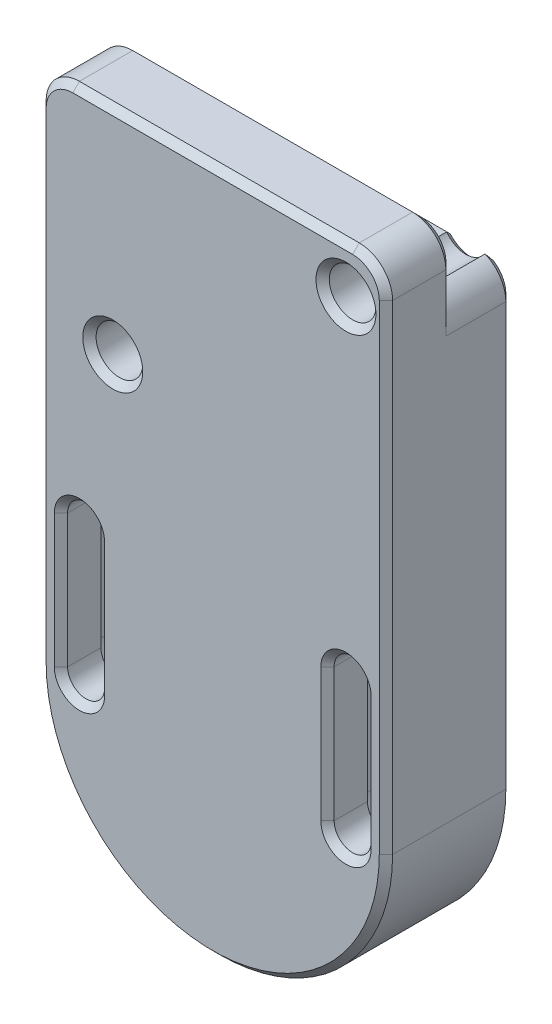
from build123d import *

# Parameters (mm, degrees)
SKETCH1_R           = 3.5
BOSS_EXTRUDE1_DEPTH = 19
CUT_EXTRUDE1_DEPTH  = 272.151249306
CUT_EXTRUDE2_DEPTH  = 272.151249306
CUT_EXTRUDE3_DEPTH  = 13
SKETCH5_W           = 9
SKETCH5_H           = 9
CUT_EXTRUDE4_DEPTH  = 91.033327163
FILLET1_R           = 5
CHAMFER1_SIZE       = 1


# Some blends are built 0.0001 mm under size
with BuildPart() as part:
    # Sketch1 → Boss-Extrude1 (new body)
    with BuildSketch(Plane.XY):
        Polygon((261, 71), (260, 71), (255, 71), (210, 71), (209, 71), (209, 41), (209, -59), (210, -59), (260, -59), (261, -59), align=None)
        with Locations((255, 64)):
            Circle(SKETCH1_R, mode=Mode.SUBTRACT)
        with Locations((220, 39)):
            Circle(SKETCH1_R, mode=Mode.SUBTRACT)
    extrude(amount=BOSS_EXTRUDE1_DEPTH)

    # Sketch2 → Cut-Extrude1 (cut, through all)
    with BuildSketch(Plane.XY.offset(19)):
        with BuildLine():
            Line((209, -59), (261, -59))
            Line((261, -59), (261, -6))
            ThreePointArc((261, -6), (235, -32), (209, -6))
            Line((209, -6), (209, -59))
        make_face()
    extrude(amount=-CUT_EXTRUDE1_DEPTH, mode=Mode.SUBTRACT)

    # Sketch3 → Cut-Extrude2 (cut, through all)
    with BuildSketch(Plane.XY.offset(19)):
        with BuildLine():
            Line((212.225, 14), (212.225, -6))
            ThreePointArc((212.225, -6), (215, -8.775), (217.775, -6))
            Line((217.775, -6), (217.775, 14))
            ThreePointArc((217.775, 14), (215, 16.775), (212.225, 14))
        make_face()
        with BuildLine():
            Line((252.225, 14), (252.225, -6))
            ThreePointArc((252.225, -6), (255, -8.775), (257.775, -6))
            Line((257.775, -6), (257.775, 14))
            ThreePointArc((257.775, 14), (255, 16.775), (252.225, 14))
        make_face()
    extrude(amount=-CUT_EXTRUDE2_DEPTH, mode=Mode.SUBTRACT)

    # Sketch4 → Cut-Extrude3 (cut)
    with BuildSketch(Plane(origin=(0, 0, 0), x_dir=(-1, 0, 0), z_dir=(0, 0, -1))):
        with BuildLine():
            Line((-251, 14), (-251, -6))
            ThreePointArc((-251, -6), (-255, -10), (-259, -6))
            Line((-259, -6), (-259, 14))
            ThreePointArc((-259, 14), (-255, 18), (-251, 14))
        make_face()
        with BuildLine():
            Line((-219, 14), (-219, -6))
            ThreePointArc((-219, -6), (-215, -10), (-211, -6))
            Line((-211, -6), (-211, 14))
            ThreePointArc((-211, 14), (-215, 18), (-219, 14))
        make_face()
    extrude(amount=-CUT_EXTRUDE3_DEPTH, mode=Mode.SUBTRACT)

    # Sketch5 → Cut-Extrude4 (cut, through all)
    with BuildSketch(Plane(origin=(261, 0, 0), x_dir=(0, 0, -1), z_dir=(1, 0, 0))):
        with Locations((-4.5, 66.5)):
            Rectangle(SKETCH5_W, SKETCH5_H)
    extrude(amount=-CUT_EXTRUDE4_DEPTH, mode=Mode.SUBTRACT)

    # Fillet1
    # the kernel refuses this fillet: 5 mm, written as the material it takes off along each edge
    with BuildSketch(Plane(origin=(209, 62, 9), x_dir=(0, -1, 0), z_dir=(0, 0, -1))) as fillet1_piece_1:
        with BuildLine():
            CenterArc((FILLET1_R, -FILLET1_R), FILLET1_R, 90, 90)
            Line((0, -FILLET1_R), (-FILLET1_R * 0.02, -FILLET1_R))
            Line((-FILLET1_R * 0.02, -FILLET1_R), (-FILLET1_R * 0.02, FILLET1_R * 0.02))
            Line((-FILLET1_R * 0.02, FILLET1_R * 0.02), (FILLET1_R, FILLET1_R * 0.02))
            Line((FILLET1_R, FILLET1_R * 0.02), (FILLET1_R, 0))
        make_face()
    extrude(amount=21.5, mode=Mode.SUBTRACT)
    with BuildSketch(Plane(origin=(261, 62, 9), x_dir=(0, -1, 0), z_dir=(0, 0, -1))) as fillet1_piece_2:
        with BuildLine():
            CenterArc((4.636222886, 5), FILLET1_R, 201.990710665, 68.009289335)
            Line((0, 3.127718677), (-0.092724458, 3.09027305))
            ThreePointArc((-0.092724458, 3.09027305), (-0.1, 1.563859338), (-0.1, 0))
            Line((-0.1, 0), (0, -0.1))
            Line((0, -0.1), (4.636222886, -0.1))
            Line((4.636222886, -0.1), (4.636222886, 0))
        make_face()
    extrude(amount=20.590557214, mode=Mode.SUBTRACT)
    with BuildSketch(Plane(origin=(209, 71, -3.5), x_dir=(1, 0, 0), z_dir=(0, 0, 1))) as fillet1_piece_3:
        with BuildLine():
            CenterArc((FILLET1_R, -FILLET1_R), FILLET1_R, 90, 90)
            Line((0, -FILLET1_R), (-FILLET1_R * 0.02, -FILLET1_R))
            Line((-FILLET1_R * 0.02, -FILLET1_R), (-FILLET1_R * 0.02, FILLET1_R * 0.02))
            Line((-FILLET1_R * 0.02, FILLET1_R * 0.02), (FILLET1_R, FILLET1_R * 0.02))
            Line((FILLET1_R, FILLET1_R * 0.02), (FILLET1_R, 0))
        make_face()
    extrude(amount=35, mode=Mode.SUBTRACT)
    with BuildSketch(Plane(origin=(261, 71, -3.5), x_dir=(-1, 0, 0), z_dir=(0, 0, 1))) as fillet1_piece_4:
        with BuildLine():
            CenterArc((FILLET1_R, FILLET1_R), FILLET1_R, 180, 90)
            Line((0, FILLET1_R), (-FILLET1_R * 0.02, FILLET1_R))
            Line((-FILLET1_R * 0.02, FILLET1_R), (-FILLET1_R * 0.02, -FILLET1_R * 0.02))
            Line((-FILLET1_R * 0.02, -FILLET1_R * 0.02), (FILLET1_R, -FILLET1_R * 0.02))
            Line((FILLET1_R, -FILLET1_R * 0.02), (FILLET1_R, 0))
        make_face()
    extrude(amount=35, mode=Mode.SUBTRACT)

    # Chamfer1
    chamfer1_edges = [part.edges().sort_by_distance(p)[0] for p in [
        (255, 60.5, 0),
        (216.5, 39, 0),
        (251.5, 64, 19),
        (209, 61.5, 9),
        (209, 25.5, 0),
        (209, 30, 19),
        (233.063859338, 62, 0),
        (261, 25.681888557, 0),
        (260.144961195, 60.160077651, 0),
        (210.464466094, 60.535533906, 0),
        (261, 61.681888557, 9),
        (261, 30, 19),
        (235, 71, 9),
        (259.535533906, 69.535533906, 9),
        (210.464466094, 69.535533906, 9),
        (235, 71, 19),
        (259.535533906, 69.535533906, 19),
        (210.464466094, 69.535533906, 19),
        (235, -32, 0),
        (235, -32, 19),
        (255, 16.775, 19),
        (252.225, 4, 19),
        (255, -8.775, 19),
        (257.775, 4, 19),
        (215, 16.775, 19),
        (212.225, 4, 19),
        (215, -8.775, 19),
        (217.775, 4, 19),
        (216.5, 39, 19),
        (255, 18, 0),
        (259, 4, 0),
        (255, -10, 0),
        (251, 4, 0),
        (215, 18, 0),
        (219, 4, 0),
        (215, -10, 0),
        (211, 4, 0),
    ]]
    chamfer(chamfer1_edges, length=CHAMFER1_SIZE - 0.0001)  # a hair under: the kernel refuses the full size


solid = part.part
